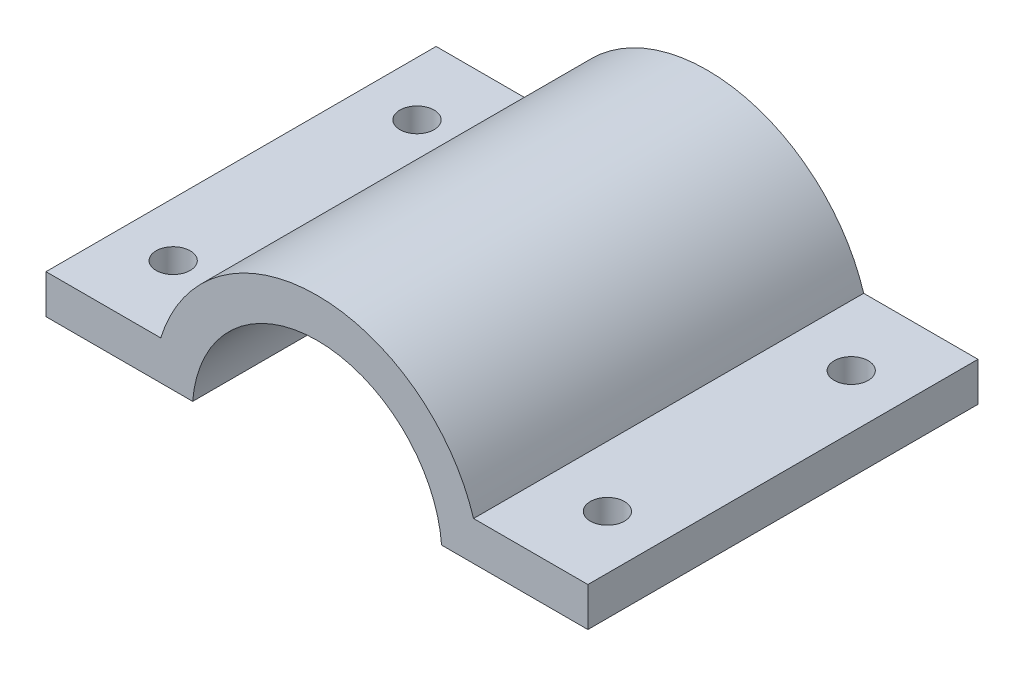
from build123d import *

# Parameters (mm, degrees)
BOSS_EXTRUDE1_DEPTH = 40
CUT_EXTRUDE1_REACH  = 52.121
SKETCH2_R           = 1.75


with BuildPart() as part:
    # Sketch1 → Boss-Extrude1 (new body)
    with BuildSketch(Plane(origin=(0, 0, 0), x_dir=(0, 1, 0), z_dir=(0, 0, 1))):
        with BuildLine():
            Line((1, 12.760877713), (1, 27.8))
            Line((1, 27.8), (5, 27.8))
            Line((5, 27.8), (5, 16.038703189))
            ThreePointArc((5, 16.038703189), (16.8, 0), (5, -16.038703189))
            Line((5, -16.038703189), (5, -27.760877713))
            Line((5, -27.760877713), (1, -27.760877713))
            Line((1, -27.760877713), (1, -12.760877713))
            ThreePointArc((1, -12.760877713), (12.8, 0), (1, 12.760877713))
        make_face()
    extrude(amount=BOSS_EXTRUDE1_DEPTH)

    # Sketch2 → Cut-Extrude1 (cut, up to next)
    with BuildSketch(Plane(origin=(0, 5, 0), x_dir=(-1, 0, 0), z_dir=(0, 1, 0)), mode=Mode.PRIVATE) as cut_extrude1_sk1:
        with Locations((-22.260877713, 32.5)):
            Circle(SKETCH2_R)
    cut_extrude1_tool1 = extrude(cut_extrude1_sk1.sketch, amount=-CUT_EXTRUDE1_REACH, mode=Mode.PRIVATE) & part.part
    # Sketch2 → Cut-Extrude1 (cut, up to next)
    with BuildSketch(Plane(origin=(0, 5, 0), x_dir=(-1, 0, 0), z_dir=(0, 1, 0)), mode=Mode.PRIVATE) as cut_extrude1_sk2:
        with Locations((-22.260877713, 7.5)):
            Circle(SKETCH2_R)
    cut_extrude1_tool2 = extrude(cut_extrude1_sk2.sketch, amount=-CUT_EXTRUDE1_REACH, mode=Mode.PRIVATE) & part.part
    # Sketch2 → Cut-Extrude1 (cut, up to next)
    with BuildSketch(Plane(origin=(0, 5, 0), x_dir=(-1, 0, 0), z_dir=(0, 1, 0)), mode=Mode.PRIVATE) as cut_extrude1_sk3:
        with Locations((22.260877713, 7.5)):
            Circle(SKETCH2_R)
    cut_extrude1_tool3 = extrude(cut_extrude1_sk3.sketch, amount=-CUT_EXTRUDE1_REACH, mode=Mode.PRIVATE) & part.part
    # Sketch2 → Cut-Extrude1 (cut, up to next)
    with BuildSketch(Plane(origin=(0, 5, 0), x_dir=(-1, 0, 0), z_dir=(0, 1, 0)), mode=Mode.PRIVATE) as cut_extrude1_sk4:
        with Locations((22.260877713, 32.5)):
            Circle(SKETCH2_R)
    cut_extrude1_tool4 = extrude(cut_extrude1_sk4.sketch, amount=-CUT_EXTRUDE1_REACH, mode=Mode.PRIVATE) & part.part
    add(cut_extrude1_tool1.solids().sort_by_distance((22.260878, 5, 32.5))[0], mode=Mode.SUBTRACT)
    add(cut_extrude1_tool2.solids().sort_by_distance((22.260878, 5, 7.5))[0], mode=Mode.SUBTRACT)
    add(cut_extrude1_tool3.solids().sort_by_distance((-22.260878, 5, 7.5))[0], mode=Mode.SUBTRACT)
    add(cut_extrude1_tool4.solids().sort_by_distance((-22.260878, 5, 32.5))[0], mode=Mode.SUBTRACT)


solid = part.part
